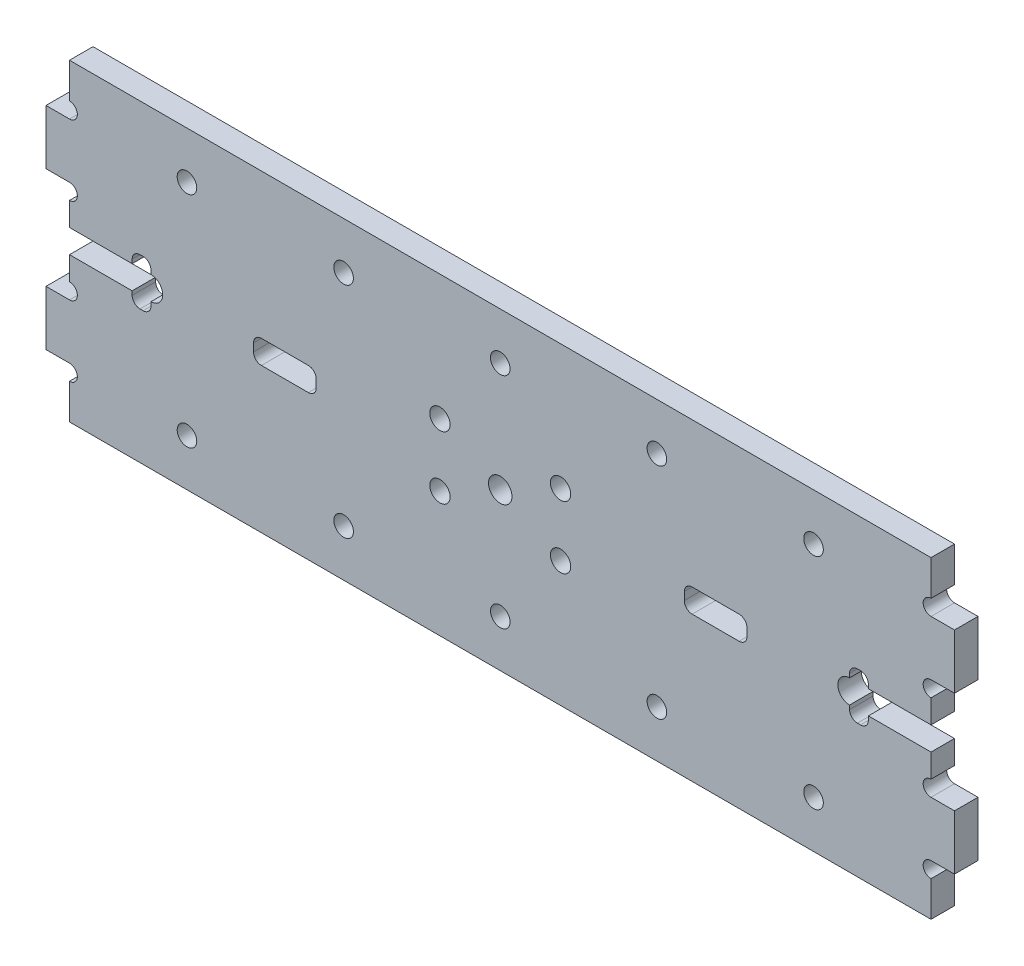
from build123d import *

# Parameters (mm, degrees)
SKETCH1_W           = 110
SKETCH1_H           = 40
BOSS_EXTRUDE1_DEPTH = 3
BOSS_EXTRUDE2_DEPTH = 3
SKETCH3_R           = 1.5
CUT_EXTRUDE1_DEPTH  = 3
CUT_EXTRUDE2_DEPTH  = 3
FILLET6_R           = 1
SKETCH5_W           = 8
SKETCH5_H           = 3
CUT_EXTRUDE3_DEPTH  = 10
FILLET7_R           = 1
SKETCH6_R           = 1.25
CUT_EXTRUDE4_DEPTH  = 62.424750712
SKETCH7_R           = 1.3
CUT_EXTRUDE5_DEPTH  = 10


with BuildPart() as part:
    # Sketch1 → Boss-Extrude1 (new body)
    with BuildSketch(Plane.XY):
        Rectangle(SKETCH1_W, SKETCH1_H)
    extrude(amount=BOSS_EXTRUDE1_DEPTH)

    # Sketch2 → Boss-Extrude2 (add)
    with BuildSketch(Plane.XY.offset(3)):
        Polygon((58, 10), (58, 13.5), (55, 13.5), (55, 6.5), (58, 6.5), align=None)
        Polygon((55, -10), (55, -6.5), (58, -6.5), (58, -13.5), (55, -13.5), align=None)
        Polygon((-55, 6.5), (-55, 13.5), (-58, 13.5), (-58, 10), (-58, 6.5), align=None)
        Polygon((-55, -13.5), (-55, -10), (-55, -6.5), (-58, -6.5), (-58, -13.5), align=None)
    extrude(amount=-BOSS_EXTRUDE2_DEPTH)

    # Sketch3 → Cut-Extrude1 (cut)
    with BuildSketch(Plane.XY.offset(3)):
        Circle(SKETCH3_R)
        with BuildLine():
            Line((-55, 15.5), (-55, 13.5))
            ThreePointArc((-55, 13.5), (-54, 14.5), (-55, 15.5))
        make_face()
        with BuildLine():
            ThreePointArc((-55, 4.5), (-54, 5.5), (-55, 6.5))
            Line((-55, 6.5), (-55, 4.5))
        make_face()
        with BuildLine():
            ThreePointArc((-55, -6.5), (-54, -5.5), (-55, -4.5))
            Line((-55, -4.5), (-55, -6.5))
        make_face()
        with BuildLine():
            ThreePointArc((-55, -15.5), (-54, -14.5), (-55, -13.5))
            Line((-55, -13.5), (-55, -15.5))
        make_face()
        with BuildLine():
            ThreePointArc((55, 15.5), (54, 14.5), (55, 13.5))
            Line((55, 13.5), (55, 15.5))
        make_face()
        with BuildLine():
            Line((55, -6.5), (55, -4.5))
            ThreePointArc((55, -4.5), (54, -5.5), (55, -6.5))
        make_face()
        with BuildLine():
            Line((55, 4.5), (55, 6.5))
            ThreePointArc((55, 6.5), (54, 5.5), (55, 4.5))
        make_face()
        with BuildLine():
            Line((55, -15.5), (55, -13.5))
            ThreePointArc((55, -13.5), (54, -14.5), (55, -15.5))
        make_face()
    extrude(amount=-CUT_EXTRUDE1_DEPTH, mode=Mode.SUBTRACT)

    # Sketch4 → Cut-Extrude2 (cut)
    with BuildSketch(Plane.XY.offset(3)):
        with BuildLine():
            Line((-47, 1.5), (-55, 1.5))
            Line((-55, 1.5), (-55, -1.5))
            Line((-55, -1.5), (-47, -1.5))
            Line((-47, -1.5), (-47, -3))
            Line((-47, -3), (-44.6, -3))
            Line((-44.6, -3), (-44.6, -1.5))
            ThreePointArc((-44.6, -1.5), (-43.1, 0), (-44.6, 1.5))
            Line((-44.6, 1.5), (-44.6, 3))
            Line((-44.6, 3), (-47, 3))
            Line((-47, 3), (-47, 1.5))
        make_face()
        with BuildLine():
            Line((47, 3), (44.6, 3))
            Line((44.6, 3), (44.6, 1.5))
            ThreePointArc((44.6, 1.5), (43.1, 0), (44.6, -1.5))
            Line((44.6, -1.5), (44.6, -3))
            Line((44.6, -3), (47, -3))
            Line((47, -3), (47, -1.5))
            Line((47, -1.5), (55, -1.5))
            Line((55, -1.5), (55, 1.5))
            Line((55, 1.5), (47, 1.5))
            Line((47, 1.5), (47, 3))
        make_face()
    extrude(amount=-CUT_EXTRUDE2_DEPTH, mode=Mode.SUBTRACT)

    # Fillet6
    fillet6_edges = [part.edges().sort_by_distance(p)[0] for p in [
        (-44.6, 3, 1.5),
        (-47, 3, 1.5),
        (-44.6, -3, 1.5),
        (-47, -3, 1.5),
        (47, 3, 1.5),
        (44.6, 3, 1.5),
        (47, -3, 1.5),
        (44.6, -3, 1.5),
    ]]
    fillet(fillet6_edges, radius=FILLET6_R)

    # Sketch5 → Cut-Extrude3 (cut)
    with BuildSketch(Plane.XY.offset(3)):
        with Locations((-27.5, 0)):
            Rectangle(SKETCH5_W, SKETCH5_H)
        with Locations((27.5, 0)):
            Rectangle(SKETCH5_W, SKETCH5_H)
    extrude(amount=-CUT_EXTRUDE3_DEPTH, mode=Mode.SUBTRACT)

    # Fillet7
    fillet7_edges = [part.edges().sort_by_distance(p)[0] for p in [
        (-31.5, -1.5, 1.5),
        (-31.5, 1.5, 1.5),
        (-23.5, 1.5, 1.5),
        (23.5, -1.5, 1.5),
        (23.5, 1.5, 1.5),
        (31.5, 1.5, 1.5),
        (31.5, -1.5, 1.5),
        (-23.5, -1.5, 1.5),
    ]]
    fillet(fillet7_edges, radius=FILLET7_R)

    # Sketch6 → Cut-Extrude4 (cut, through all)
    with BuildSketch(Plane.XY.offset(3)):
        with Locations((0, 14)):
            Circle(SKETCH6_R)
        with Locations((0, -14)):
            Circle(SKETCH6_R)
        with Locations((20, -14)):
            Circle(SKETCH6_R)
        with Locations((20, 14)):
            Circle(SKETCH6_R)
        with Locations((40, -14)):
            Circle(SKETCH6_R)
        with Locations((40, 14)):
            Circle(SKETCH6_R)
        with Locations((-20, -14)):
            Circle(SKETCH6_R)
        with Locations((-20, 14)):
            Circle(SKETCH6_R)
        with Locations((-40, -14)):
            Circle(SKETCH6_R)
        with Locations((-40, 14)):
            Circle(SKETCH6_R)
    extrude(amount=-CUT_EXTRUDE4_DEPTH, mode=Mode.SUBTRACT)

    # Sketch7 → Cut-Extrude5 (cut)
    with BuildSketch(Plane.XY.offset(3)):
        with Locations((-7.7, 4)):
            Circle(SKETCH7_R)
        with Locations((7.7, 4)):
            Circle(SKETCH7_R)
        with Locations((7.7, -4)):
            Circle(SKETCH7_R)
        with Locations((-7.7, -4)):
            Circle(SKETCH7_R)
    extrude(amount=-CUT_EXTRUDE5_DEPTH, mode=Mode.SUBTRACT)


solid = part.part
